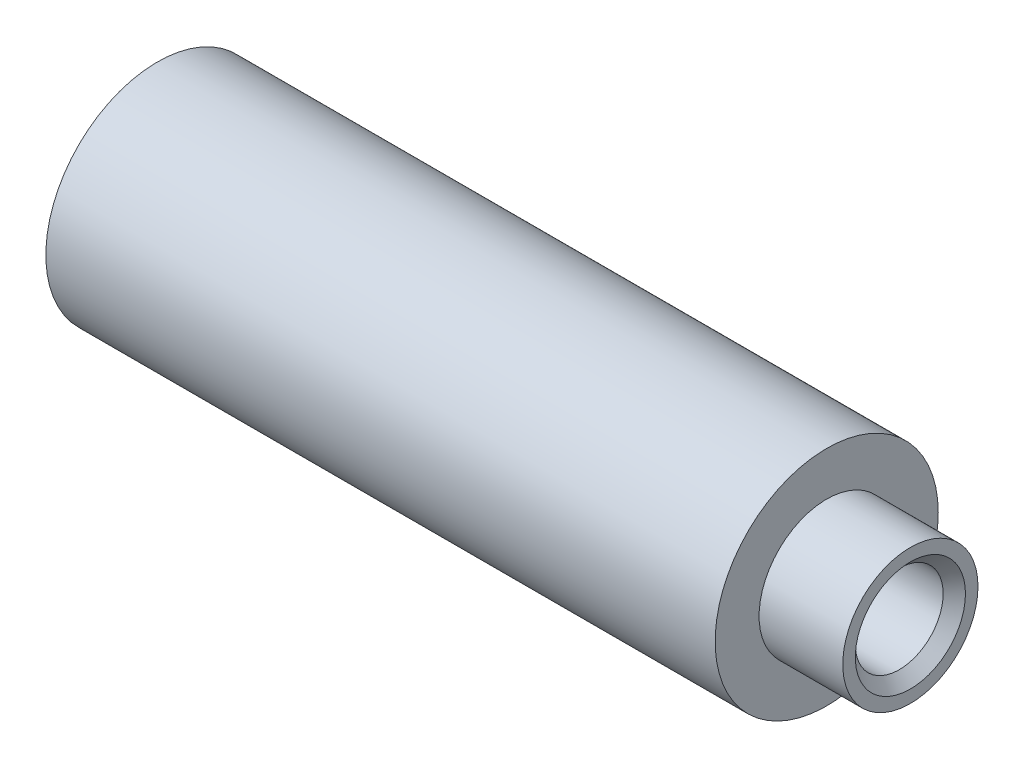
from build123d import *

# Parameters (mm, degrees)
SKIZZE1_R                       = 4
SKIZZE1_R_2                     = 1.575
AUFSATZ_LINEAR_AUSTRAGEN1_DEPTH = 27
SKIZZE2_OUTSIDE_W               = 15.854
SKIZZE2_OUTSIDE_H               = 15.854
SKIZZE2_OUTSIDE_R               = 2.425
SCHNITT_LINEAR_AUSTRAGEN1_DEPTH = 3
FASE1_SIZE                      = 0.4


with BuildPart() as part:
    # Skizze1 → Aufsatz-Linear austragen1 (new body)
    with BuildSketch(Plane(origin=(0, 0, 0), x_dir=(0, 0, -1), z_dir=(1, 0, 0))):
        Circle(SKIZZE1_R)
        Circle(SKIZZE1_R_2, mode=Mode.SUBTRACT)
    extrude(amount=AUFSATZ_LINEAR_AUSTRAGEN1_DEPTH)

    # Skizze2 outside → Schnitt-Linear austragen1 (cut)
    with BuildSketch(Plane(origin=(27, 0, 0), x_dir=(0, 0, -1), z_dir=(1, 0, 0))):
        Rectangle(SKIZZE2_OUTSIDE_W, SKIZZE2_OUTSIDE_H)
        Circle(SKIZZE2_OUTSIDE_R, mode=Mode.SUBTRACT)
    extrude(amount=-SCHNITT_LINEAR_AUSTRAGEN1_DEPTH, mode=Mode.SUBTRACT)

    # Fase1
    fase1_edges = [part.edges().sort_by_distance(p)[0] for p in [
        (0, 0, 1.575),
        (27, 0, 1.575),
    ]]
    chamfer(fase1_edges, length=FASE1_SIZE)


solid = part.part
